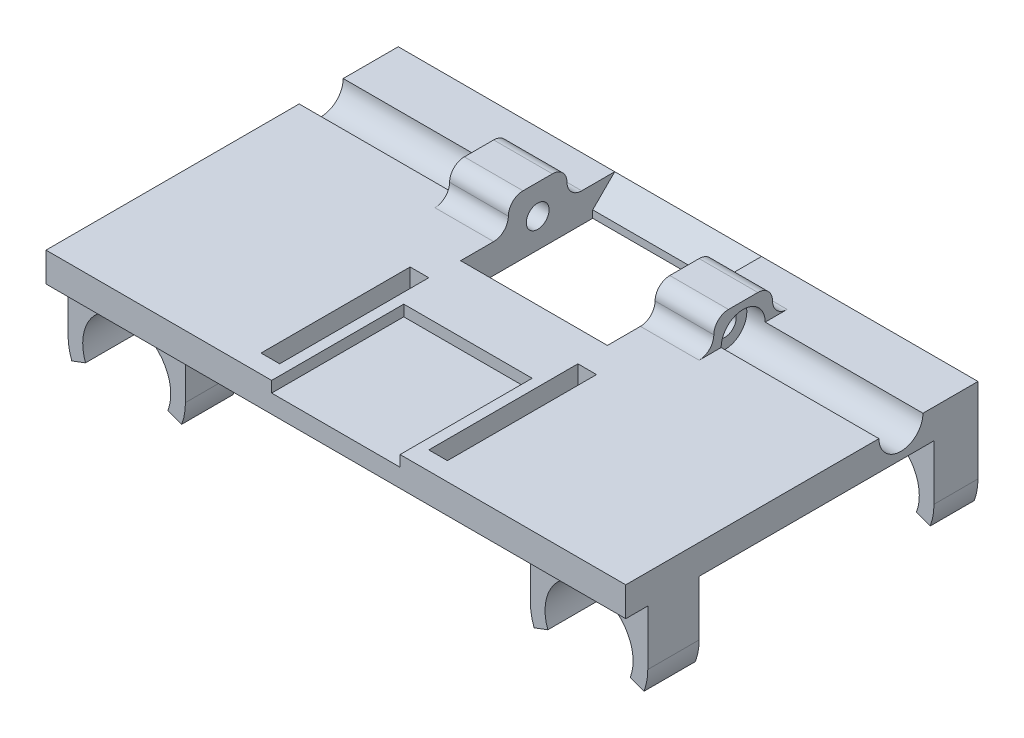
from build123d import *

# Parameters (mm, degrees)
SKETCH_1_W          = 79
SKETCH_1_H          = 48
SKETCH_1_W_2        = 2.54
SKETCH_1_H_2        = 20.32
SKETCH_1_W_3        = 20
SKETCH_1_H_3        = 15
EXTRUDE_1_DEPTH     = 4
SKETCH_3_W          = 8
SKETCH_3_H          = 4
EXTRUDE_2_DEPTH     = 8
FILLET_1_R          = 2
SKETCH_5_R          = 3
CUT_EXTRUDE_1_DEPTH = 24
SKETCH2_W           = 8
SKETCH2_H           = 4
BOSS_EXTRUDE1_DEPTH = 8
FILLET1_R           = 2
CUT_EXTRUDE2_START  = -24
SKETCH3_R           = 3
CUT_EXTRUDE2_DEPTH  = 24
CHAMFER1_SIZE       = 3
CUT_EXTRUDE5_REACH  = 75.437
SKETCH8_R           = 1.55
BOSS_EXTRUDE4_DEPTH = 6
SKETCH10_W          = 17.5
SKETCH10_H          = 18
CUT_EXTRUDE6_DEPTH  = 1.5
BOSS_EXTRUDE5_DEPTH = 7


with BuildPart() as part:
    # Эскиз1 → Бобышка-Вытянуть1 (new body)
    with BuildSketch(Plane(origin=(0, 0, 0), x_dir=(1, 0, 0), z_dir=(0, 1, 0))):
        with Locations((39.5, 24)):
            Rectangle(SKETCH_1_W, SKETCH_1_H)
        with Locations((28.07, 12.66)):
            Rectangle(SKETCH_1_W_2, SKETCH_1_H_2, mode=Mode.SUBTRACT)
        with Locations((50.93, 12.66)):
            Rectangle(SKETCH_1_W_2, SKETCH_1_H_2, mode=Mode.SUBTRACT)
        with Locations((39.5, 37.5)):
            Rectangle(SKETCH_1_W_3, SKETCH_1_H_3, mode=Mode.SUBTRACT)
    extrude(amount=EXTRUDE_1_DEPTH)

    # Эскиз3 → Бобышка-Вытянуть2 (add)
    with BuildSketch(Plane(origin=(29.5, 0, 0), x_dir=(0, 0, -1), z_dir=(1, 0, 0))):
        with Locations((37.5, 6)):
            Rectangle(SKETCH_3_W, SKETCH_3_H)
    extrude(amount=-EXTRUDE_2_DEPTH)

    # Скругление1
    fillet_1_edges = [part.edges().sort_by_distance(p)[0] for p in [
        (25.5, 4, -41.5),
        (25.5, 4, -33.5),
    ]]
    fillet(fillet_1_edges, radius=FILLET_1_R)
    fillet_1_2_edges = [part.edges().sort_by_distance(p)[0] for p in [
        (25.5, 8, -41.5),
        (25.5, 8, -33.5),
    ]]
    fillet(fillet_1_2_edges, radius=FILLET_1_R - 0.0001)  # a hair under: the kernel refuses the full size

    # Эскиз5 → Вырез-Вытянуть1 (cut)
    with BuildSketch(Plane.ZY):
        with Locations((-37.5, 4)):
            Circle(SKETCH_5_R)
    extrude(amount=-CUT_EXTRUDE_1_DEPTH, mode=Mode.SUBTRACT)

    # Sketch2 → Boss-Extrude1 (add)
    with BuildSketch(Plane.ZY.offset(-49.5)):
        with Locations((-37.5, 6)):
            Rectangle(SKETCH2_W, SKETCH2_H)
    extrude(amount=-BOSS_EXTRUDE1_DEPTH)

    # Fillet1
    fillet1_edges = [part.edges().sort_by_distance(p)[0] for p in [
        (53.5, 4, -33.5),
    ]]
    fillet(fillet1_edges, radius=FILLET1_R)
    fillet1_2_edges = [part.edges().sort_by_distance(p)[0] for p in [
        (53.5, 4, -41.5),
    ]]
    fillet(fillet1_2_edges, radius=FILLET1_R)
    fillet1_3_edges = [part.edges().sort_by_distance(p)[0] for p in [
        (53.5, 8, -33.5),
    ]]
    fillet(fillet1_3_edges, radius=FILLET1_R - 0.0001)  # a hair under: the kernel refuses the full size
    fillet1_4_edges = [part.edges().sort_by_distance(p)[0] for p in [
        (53.5, 8, -41.5),
    ]]
    fillet(fillet1_4_edges, radius=FILLET1_R - 0.0001)  # a hair under: the kernel refuses the full size

    # Sketch3 → Cut-Extrude2 (cut)
    with BuildSketch(Plane(origin=(79, 0, 0), x_dir=(0, 0, -1), z_dir=(1, 0, 0)).offset(CUT_EXTRUDE2_START)):
        with Locations(Location((37.5, 4, 0), (0, 0, 180))):
            Circle(SKETCH3_R)
    extrude(amount=CUT_EXTRUDE2_DEPTH, mode=Mode.SUBTRACT)

    # Chamfer1
    chamfer1_edges = [part.edges().sort_by_distance(p)[0] for p in [
        (39.5, 4, -30),
        (39.5, 4, -45),
    ]]
    chamfer(chamfer1_edges, length=CHAMFER1_SIZE - 0.0001)  # a hair under: the kernel refuses the full size

    # Cut-Extrude5: up to this face of the body (flat: up to its plane)
    cut_extrude5_end = Plane(part.part.faces().sort_by_distance((24, 4, -37.5))[0])
    # Sketch8 → Cut-Extrude5 (cut, up to the picked face)
    with BuildSketch(Plane(origin=(55, 0, 0), x_dir=(0, 0, -1), z_dir=(1, 0, 0)), mode=Mode.PRIVATE) as cut_extrude5_sk1:
        with Locations((37.5, 4)):
            Circle(SKETCH8_R)
    cut_extrude5_tool1 = split(extrude(cut_extrude5_sk1.sketch, amount=-CUT_EXTRUDE5_REACH, mode=Mode.PRIVATE), bisect_by=cut_extrude5_end, keep=Keep.BOTH, mode=Mode.PRIVATE)
    add(cut_extrude5_tool1.solids().sort_by(Axis((55, 4, -37.5), (-1, 0, 0)))[0], mode=Mode.SUBTRACT)

    # Sketch9 → Boss-Extrude4 (add)
    with BuildSketch(Plane(origin=(0, 0, -48), x_dir=(-1, 0, 0), z_dir=(0, 0, -1))):
        with BuildLine():
            Line((-79, 0), (-63, 0))
            Line((-63, 0), (-63, -7.5))
            ThreePointArc((-63, -7.5), (-63.129574487, -8.934016124), (-63.514100561, -10.321579273))
            Line((-63.514100561, -10.321579273), (-65.385575421, -9.616184455))
            ThreePointArc((-65.385575421, -9.616184455), (-71, -1.5), (-76.614424579, -9.616184455))
            Line((-76.614424579, -9.616184455), (-78.485899439, -10.321579273))
            ThreePointArc((-78.485899439, -10.321579273), (-78.870425513, -8.934016124), (-79, -7.5))
            Line((-79, -7.5), (-79, 0))
        make_face()
        with BuildLine():
            Line((-13.614424579, -9.616184455), (-15.485899439, -10.321579273))
            ThreePointArc((-15.485899439, -10.321579273), (-15.870425513, -8.934016124), (-16, -7.5))
            Line((-16, -7.5), (-16, 0))
            Line((-16, 0), (0, 0))
            Line((0, 0), (0, -7.5))
            ThreePointArc((0, -7.5), (-0.129574487, -8.934016124), (-0.514100561, -10.321579273))
            Line((-0.514100561, -10.321579273), (-2.385575421, -9.616184455))
            ThreePointArc((-2.385575421, -9.616184455), (-8, -1.5), (-13.614424579, -9.616184455))
        make_face()
    extrude(amount=-BOSS_EXTRUDE4_DEPTH)

    # Sketch10 → Cut-Extrude6 (cut)
    with BuildSketch(Plane(origin=(0, 4, 0), x_dir=(1, 0, 0), z_dir=(0, 1, 0))):
        with Locations((39.5, 9)):
            Rectangle(SKETCH10_W, SKETCH10_H)
    extrude(amount=-CUT_EXTRUDE6_DEPTH, mode=Mode.SUBTRACT)

    # Sketch13 → Boss-Extrude5 (add)
    with BuildSketch(Plane.XY.offset(-10)):
        with BuildLine():
            Line((0, 0), (16, 0))
            Line((16, 0), (16, -7.5))
            ThreePointArc((16, -7.5), (15.870425513, -8.934016124), (15.485899439, -10.321579273))
            Line((15.485899439, -10.321579273), (13.614424579, -9.616184455))
            ThreePointArc((13.614424579, -9.616184455), (8, -1.5), (2.385575421, -9.616184455))
            Line((2.385575421, -9.616184455), (0.514100561, -10.321579273))
            ThreePointArc((0.514100561, -10.321579273), (0.129574487, -8.934016124), (0, -7.5))
            Line((0, -7.5), (0, 0))
        make_face()
        with BuildLine():
            Line((63, 0), (63, -7.5))
            ThreePointArc((63, -7.5), (63.129574487, -8.934016124), (63.514100561, -10.321579273))
            Line((63.514100561, -10.321579273), (65.385575421, -9.616184455))
            ThreePointArc((65.385575421, -9.616184455), (71, -1.5), (76.614424579, -9.616184455))
            Line((76.614424579, -9.616184455), (78.485899439, -10.321579273))
            ThreePointArc((78.485899439, -10.321579273), (78.870425513, -8.934016124), (79, -7.5))
            Line((79, -7.5), (79, 0))
            Line((79, 0), (63, 0))
        make_face()
    extrude(amount=BOSS_EXTRUDE5_DEPTH)


solid = part.part
